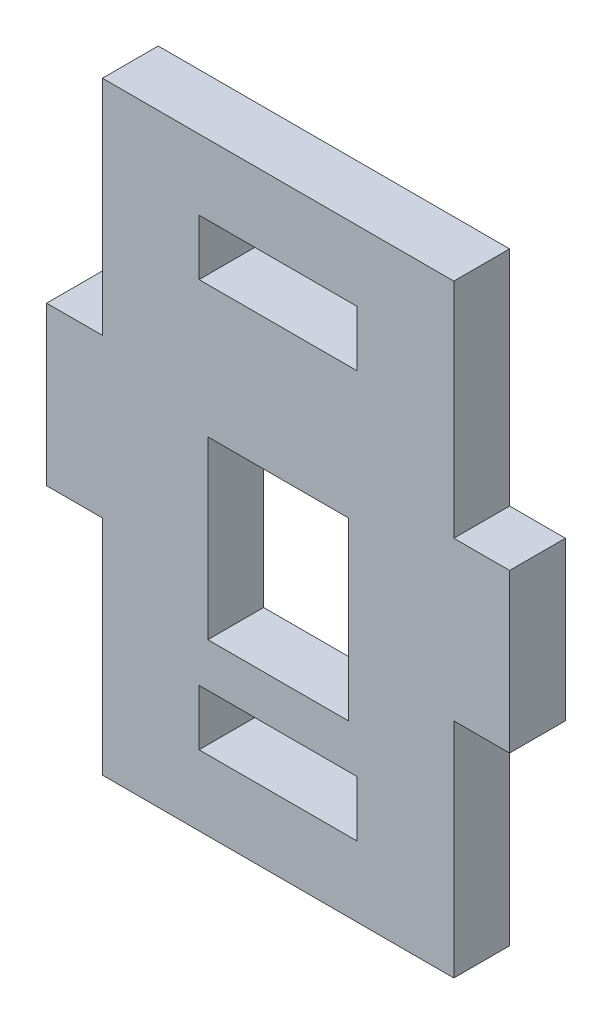
from build123d import *

# Parameters (mm, degrees)
BOSS_EXTRUDE1_DEPTH = 1.5875


with BuildPart() as part:
    # Sketch2 → Boss-Extrude1 (new, symmetric)
    with BuildSketch(Plane.XY):
        Polygon((0, 12.675), (0, 0), (20, 0), (20, 12.675), (23.175, 12.675), (23.175, 21.675), (20, 21.675), (20, 27.175), (20, 34.35), (0, 34.35), (0, 21.675), (-3.175, 21.675), (-3.175, 12.675), align=None)
        Polygon((14.5, 7.175), (14.5, 4), (10, 4), (5.5, 4), (5.5, 7.175), align=None, mode=Mode.SUBTRACT)
        Polygon((14, 9.675), (10, 9.675), (6, 9.675), (6, 19.675), (14, 19.675), align=None, mode=Mode.SUBTRACT)
        Polygon((14.5, 30.35), (14.5, 27.175), (5.5, 27.175), (5.5, 30.35), (10, 30.35), align=None, mode=Mode.SUBTRACT)
    extrude(amount=BOSS_EXTRUDE1_DEPTH, both=True)


solid = part.part
